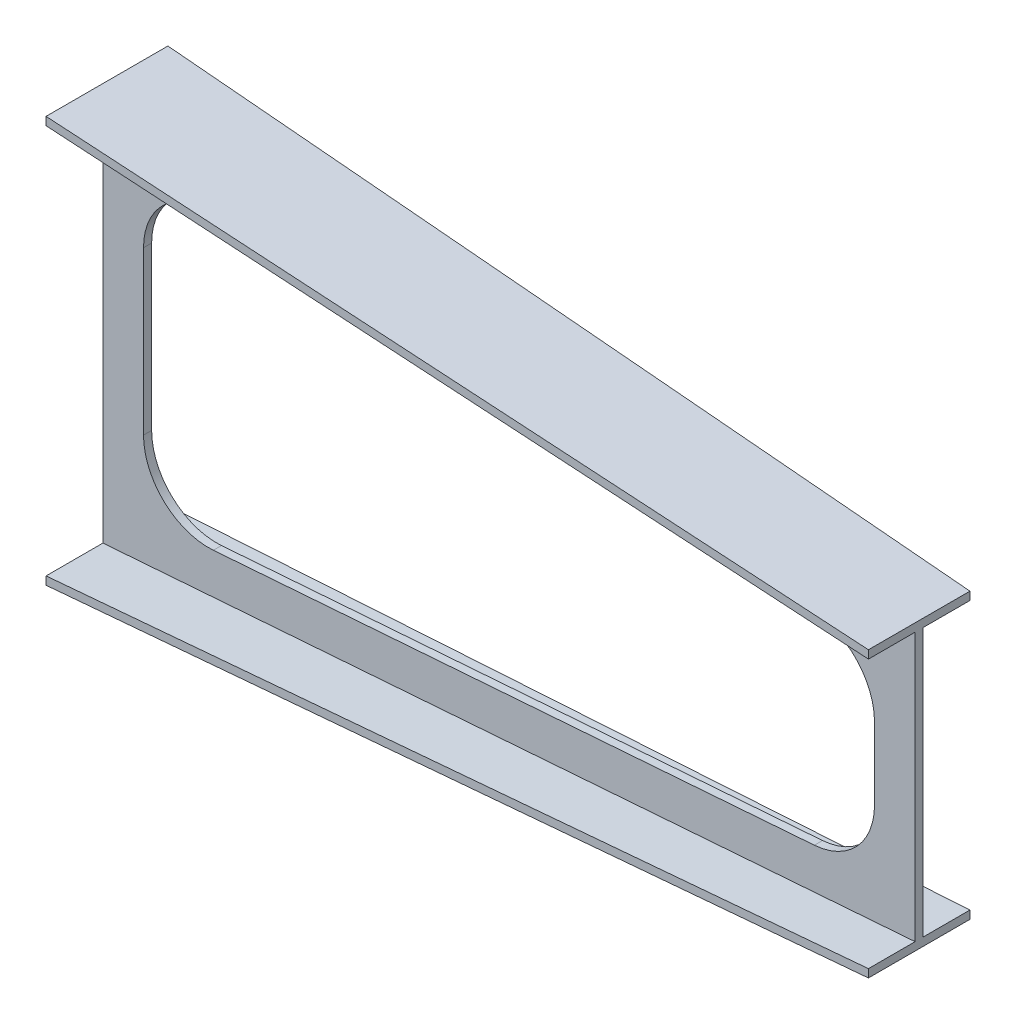
from build123d import *

# Parameters (mm, degrees)
CUT_EXTRUDE1_DEPTH = 1034.876201615


with BuildPart() as part:
    # Sketch1 → Loft l3 section 0
    with BuildSketch(Plane(origin=(0, 0, 0), x_dir=(0, 0, -1), z_dir=(1, 0, 0))):
        with BuildLine():
            Line((-80, 250), (70, 250))
            Line((70, 250), (70, 240))
            Line((70, 240), (0, 240))
            Line((0, 240), (0, -240))
            Line((0, -240), (70, -240))
            Line((70, -240), (70, -250))
            Line((70, -250), (-80, -250))
            Line((-80, -250), (-80, -240))
            Line((-80, -240), (-10, -240))
            Line((-10, -240), (-10, 240))
            Line((-10, 240), (-80, 240))
            Line((-80, 240), (-80, 250))
        make_face()
    # Sketch4 → Loft l3 section 1
    with BuildSketch(Plane(origin=(1000, 0, -1000), x_dir=(0, 0, 1), z_dir=(-1, 0, 0))):
        with BuildLine():
            Line((942.5, 175), (1067.5, 175))
            Line((1067.5, 175), (1067.5, 165))
            Line((1067.5, 165), (1010, 165))
            Line((1010, 165), (1010, -165))
            Line((1010, -165), (1067.5, -165))
            Line((1067.5, -165), (1067.5, -175))
            Line((1067.5, -175), (942.5, -175))
            Line((942.5, -175), (942.5, -165))
            Line((942.5, -165), (1000, -165))
            Line((1000, -165), (1000, 165))
            Line((1000, 165), (942.5, 165))
            Line((942.5, 165), (942.5, 175))
        make_face()
    loft()

    # Sketch6 → Cut-Extrude1 (cut, through all)
    with BuildSketch(Plane.XY.offset(10)):
        with BuildLine():
            Line((135.983195859, -179.66083251), (875.983195859, -124.16083251))
            ThreePointArc((875.983195859, -124.16083251), (928.64578275, -98.796946728), (950, -44.384887719))
            Line((950, -44.384887719), (950, 44.384887719))
            ThreePointArc((950, 44.384887719), (928.64578275, 98.796946728), (875.983195859, 124.16083251))
            Line((875.983195859, 124.16083251), (135.983195859, 179.66083251))
            ThreePointArc((135.983195859, 179.66083251), (75.587940991, 158.530670469), (50, 99.884887719))
            Line((50, 99.884887719), (50, -99.884887719))
            ThreePointArc((50, -99.884887719), (75.587940991, -158.530670469), (135.983195859, -179.66083251))
        make_face()
    extrude(amount=-CUT_EXTRUDE1_DEPTH, mode=Mode.SUBTRACT)


solid = part.part
